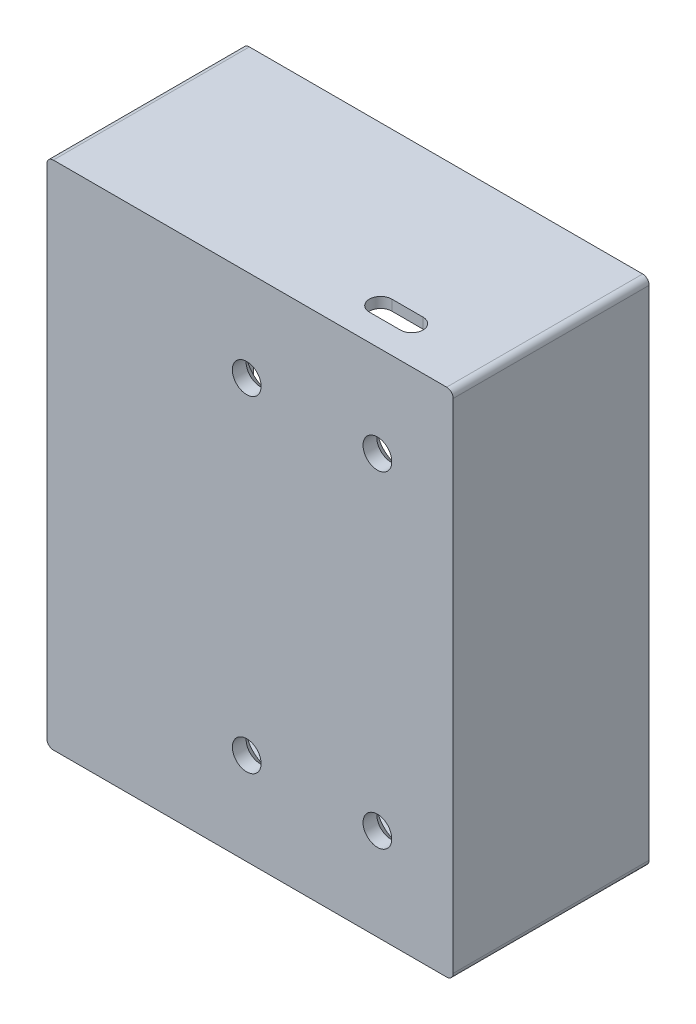
from build123d import *

# Parameters (mm, degrees)
SKETCH_1_W          = 62.2
SKETCH_1_H          = 78.2
SKETCH_1_W_2        = 59
SKETCH_1_H_2        = 75
EXTRUDE_1_DEPTH     = 30
SKETCH_2_W          = 62.2
SKETCH_2_H          = 78.2
EXTRUDE_1_2_DEPTH   = 1.6
SKETCH_3_W          = 5
SKETCH_3_H          = 5
EXTRUDE_2_DEPTH     = 3
SKETCH_4_W          = 1.5
SKETCH_4_H          = 5
EXTRUDE_3_DEPTH     = 1
SKETCH_5_W          = 1.5
SKETCH_5_H          = 5
SKETCH_5_H_2        = 4.722364884
EXTRUDE_4_DEPTH     = 1
FILLET_1_R          = 1
FILLET_2_R          = 1.8
SKETCH_6_R          = 2.2
CUT_EXTRUDE_1_DEPTH = 58.468078096
EXTRUDE_START       = 2
SKETCH_7_R          = 4
SKETCH_7_R_2        = 2.2
EXTRUDE_5_DEPTH     = 2
CHAMFER_1_SIZE      = 1.5
FILLET_3_R          = 1
CUT_EXTRUDE_2_REACH = 91.345


with BuildPart() as part:
    # Эскиз1 → Extrude 1 (new body)
    with BuildSketch(Plane.XY):
        Rectangle(SKETCH_1_W, SKETCH_1_H)
        Rectangle(SKETCH_1_W_2, SKETCH_1_H_2, mode=Mode.SUBTRACT)
    extrude(amount=EXTRUDE_1_DEPTH)

    # Эскиз2 → Extrude 1 2 (add)
    with BuildSketch(Plane.XY.offset(30)):
        Rectangle(SKETCH_2_W, SKETCH_2_H)
    extrude(amount=-EXTRUDE_1_2_DEPTH)

    # Эскиз3 → Бобышка-Вытянуть2 (add)
    with BuildSketch(Plane(origin=(0, 0, 28.4), x_dir=(-1, 0, 0), z_dir=(0, 0, -1))):
        with Locations((-27, 35)):
            Rectangle(SKETCH_3_W, SKETCH_3_H)
        with Locations((27, 35)):
            Rectangle(SKETCH_3_W, SKETCH_3_H)
        with Locations((-27, -35)):
            Rectangle(SKETCH_3_W, SKETCH_3_H)
        with Locations((27, -35)):
            Rectangle(SKETCH_3_W, SKETCH_3_H)
    extrude(amount=EXTRUDE_2_DEPTH)

    # Эскиз4 → Бобышка-Вытянуть3 (add)
    with BuildSketch(Plane.ZY.offset(-29.5)):
        with Locations((23.15, 35)):
            Rectangle(SKETCH_4_W, SKETCH_4_H)
        with Locations((23.15, -35)):
            Rectangle(SKETCH_4_W, SKETCH_4_H)
    extrude(amount=EXTRUDE_3_DEPTH)

    # Эскиз5 → Бобышка-Вытянуть4 (add)
    with BuildSketch(Plane(origin=(-29.5, 0, 0), x_dir=(0, 0, -1), z_dir=(1, 0, 0))):
        with Locations((-23.15, 35)):
            Rectangle(SKETCH_5_W, SKETCH_5_H)
        with Locations((-23.15, -35.138817558)):
            Rectangle(SKETCH_5_W, SKETCH_5_H_2)
    extrude(amount=EXTRUDE_4_DEPTH)

    # Скругление1
    fillet_1_edges = [part.edges().sort_by_distance(p)[0] for p in [
        (27, 32.5, 28.4),
        (24.5, 35, 28.4),
        (27, 32.5, 25.4),
        (24.5, 35, 25.4),
        (-24.5, 35, 28.4),
        (-27, 32.5, 28.4),
        (-24.5, 35, 25.4),
        (-27, 32.5, 25.4),
        (24.5, -35, 28.4),
        (27, -32.5, 28.4),
        (24.5, -35, 25.4),
        (27, -32.5, 25.4),
        (-27, -32.5, 28.4),
        (-24.5, -35, 28.4),
        (-27, -32.5, 25.4),
        (-24.5, -35, 25.4),
    ]]
    fillet(fillet_1_edges, radius=FILLET_1_R)

    # Скругление2
    # the kernel refuses this fillet: 1.8 mm, written as the material it adds along each edge
    with BuildSketch(Plane(origin=(29.5, -41.531128874, 23.9), x_dir=(0, 0, 1), z_dir=(0, 1, 0))) as fillet_2_piece_1_section:
        with BuildLine():
            CenterArc((1.61245155, -1.8), FILLET_2_R, 90, 63.612200039)
            Line((0, -1), (0, 0))
            Line((0, 0), (1.61245155, 0))
        make_face()
    fillet_2_piece_1 = extrude(amount=9.031128874, mode=Mode.PRIVATE)
    fillet_2_piece_1 = split(fillet_2_piece_1, bisect_by=Plane(origin=(29.5, -39.1, 23.9), z_dir=(0, 1, 0)), keep=Keep.TOP, mode=Mode.PRIVATE)
    add(fillet_2_piece_1)
    with BuildSketch(Plane(origin=(-29.5, -32.777635116, 23.9), x_dir=(0, 0, 1), z_dir=(0, -1, 0))) as fillet_2_piece_2_section:
        with BuildLine():
            CenterArc((1.61245155, -1.8), FILLET_2_R, 90, 63.612200039)
            Line((0, -1), (0, 0))
            Line((0, 0), (1.61245155, 0))
        make_face()
    fillet_2_piece_2 = extrude(amount=8.753493758, mode=Mode.PRIVATE)
    fillet_2_piece_2 = split(fillet_2_piece_2, bisect_by=Plane(origin=(-29.5, -39.1, 23.9), z_dir=(0, 1, 0)), keep=Keep.TOP, mode=Mode.PRIVATE)
    add(fillet_2_piece_2)
    with BuildSketch(Plane(origin=(-29.5, 41.531128874, 23.9), x_dir=(0, 0, 1), z_dir=(0, -1, 0))) as fillet_2_piece_3_section:
        with BuildLine():
            CenterArc((1.61245155, -1.8), FILLET_2_R, 90, 63.612200039)
            Line((0, -1), (0, 0))
            Line((0, 0), (1.61245155, 0))
        make_face()
    fillet_2_piece_3 = extrude(amount=9.031128874, mode=Mode.PRIVATE)
    fillet_2_piece_3 = split(fillet_2_piece_3, bisect_by=Plane(origin=(-29.5, 39.1, 23.9), z_dir=(0, -1, 0)), keep=Keep.TOP, mode=Mode.PRIVATE)
    add(fillet_2_piece_3)
    with BuildSketch(Plane(origin=(29.5, 41.531128874, 23.9), x_dir=(0, 0, 1), z_dir=(0, -1, 0))) as fillet_2_piece_4_section:
        with BuildLine():
            CenterArc((1.61245155, 1.8), FILLET_2_R, 206.387799961, 63.612200039)
            Line((0, 1), (0, 0))
            Line((0, 0), (1.61245155, 0))
        make_face()
    fillet_2_piece_4 = extrude(amount=9.031128874, mode=Mode.PRIVATE)
    fillet_2_piece_4 = split(fillet_2_piece_4, bisect_by=Plane(origin=(29.5, 39.1, 23.9), z_dir=(0, -1, 0)), keep=Keep.TOP, mode=Mode.PRIVATE)
    add(fillet_2_piece_4)

    # Эскиз6 → Вырез-Вытянуть1 (cut, through all)
    with BuildSketch(Plane(origin=(0, 0, 28.4), x_dir=(-1, 0, 0), z_dir=(0, 0, -1))):
        with Locations((-19.5, 25)):
            Circle(SKETCH_6_R)
        with Locations((0.5, 25)):
            Circle(SKETCH_6_R)
        with Locations((0.5, -25)):
            Circle(SKETCH_6_R)
        with Locations((-19.5, -25)):
            Circle(SKETCH_6_R)
    extrude(amount=-CUT_EXTRUDE_1_DEPTH, mode=Mode.SUBTRACT)

    # Эскиз7 → Бобышка-Вытянуть5 (add)
    # profile 1 of 4: a face of its own
    with BuildSketch(Plane(origin=(0, 0, 28.4), x_dir=(-1, 0, 0), z_dir=(0, 0, -1)).offset(EXTRUDE_START)):
        with Locations(Location((-19.5, 25, 0), (0, 0, 180))):
            Circle(SKETCH_7_R)
        with Locations((-19.5, 25)):
            Circle(SKETCH_7_R_2, mode=Mode.SUBTRACT)
    # profile 2 of 4: a face of its own
    with BuildSketch(Plane(origin=(0, 0, 28.4), x_dir=(-1, 0, 0), z_dir=(0, 0, -1)).offset(EXTRUDE_START)):
        with Locations(Location((0.5, 25, 0), (0, 0, 180))):
            Circle(SKETCH_7_R)
        with Locations((0.5, 25)):
            Circle(SKETCH_7_R_2, mode=Mode.SUBTRACT)
    # profile 3 of 4: a face of its own
    with BuildSketch(Plane(origin=(0, 0, 28.4), x_dir=(-1, 0, 0), z_dir=(0, 0, -1)).offset(EXTRUDE_START)):
        with Locations(Location((-19.5, -25, 0), (0, 0, 180))):
            Circle(SKETCH_7_R)
        with Locations((-19.5, -25)):
            Circle(SKETCH_7_R_2, mode=Mode.SUBTRACT)
    # profile 4 of 4: a face of its own
    with BuildSketch(Plane(origin=(0, 0, 28.4), x_dir=(-1, 0, 0), z_dir=(0, 0, -1)).offset(EXTRUDE_START)):
        with Locations(Location((0.5, -25, 0), (0, 0, 180))):
            Circle(SKETCH_7_R)
        with Locations((0.5, -25)):
            Circle(SKETCH_7_R_2, mode=Mode.SUBTRACT)
    extrude(amount=-EXTRUDE_5_DEPTH)

    # Фаска1
    chamfer_1_edges = [part.edges().sort_by_distance(p)[0] for p in [
        (21.7, 25, 26.4),
        (1.7, 25, 26.4),
        (21.7, -25, 26.4),
        (1.7, -25, 26.4),
    ]]
    chamfer(chamfer_1_edges, length=CHAMFER_1_SIZE)

    # Скругление3
    fillet_3_edges = [part.edges().sort_by_distance(p)[0] for p in [
        (31.1, -39.1, 15),
        (-31.1, -39.1, 15),
        (-31.1, 39.1, 15),
        (31.1, 39.1, 15),
    ]]
    fillet(fillet_3_edges, radius=FILLET_3_R)

    # Эскиз8 → Вырез-Вытянуть2 (cut, up to next)
    with BuildSketch(Plane(origin=(0, 39.1, 0), x_dir=(1, 0, 0), z_dir=(0, 1, 0)), mode=Mode.PRIVATE) as cut_extrude_2_sk1:
        with BuildLine():
            Line((18.995015929, -25.968474999), (14.239793371, -25.968474999))
            ThreePointArc((14.239793371, -25.968474999), (12.517359829, -24.246041457), (14.239793371, -22.523607914))
            Line((14.239793371, -22.523607914), (18.995015929, -22.523607914))
            ThreePointArc((18.995015929, -22.523607914), (20.717449472, -24.246041457), (18.995015929, -25.968474999))
        make_face()
    cut_extrude_2_tool1 = extrude(cut_extrude_2_sk1.sketch, amount=-CUT_EXTRUDE_2_REACH, mode=Mode.PRIVATE) & part.part
    add(cut_extrude_2_tool1.solids().sort_by_distance((16.617405, 39.1, 24.246041))[0], mode=Mode.SUBTRACT)


solid = part.part
